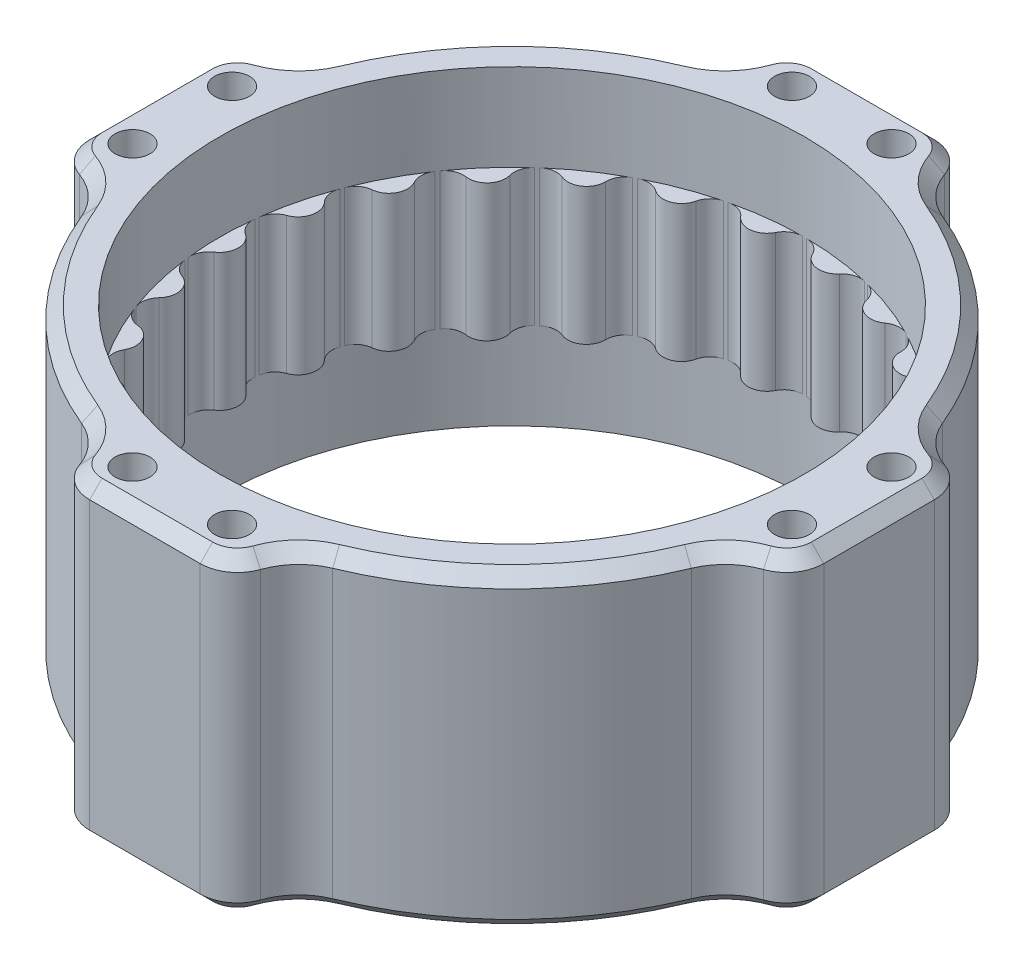
from build123d import *
from build123d.topology import SkipClean

# Parameters (mm, degrees)
SKETCH1_R                = 26.5
SKETCH1_R_2              = 23.5
BOSS_EXTRUDE4_DEPTH      = 11
SKETCH15_R               = 1.5
BOSS_EXTRUDE5_DEPTH      = 11
BOSS_EXTRUDE6_START      = 7
SKETCH7_R                = 26.5
SKETCH7_R_2              = 23.5
BOSS_EXTRUDE6_DEPTH      = 7
FILLET1_R                = 1.5
CIRPATTERN1_COUNT        = 26
FILLET1_OF_CIRPATTERN1_R = 1.5
SKETCH16_R               = 26.5
SKETCH16_R_2             = 23.5
BOSS_EXTRUDE7_DEPTH      = 7
SKETCH17_W               = 6
SKETCH17_H               = 14
BOSS_EXTRUDE8_DEPTH      = 25
SKETCH18_R               = 1.4
CUT_EXTRUDE1_DEPTH       = 25
FILLET2_R                = 5
FILLET3_R                = 3
CIRPATTERN2_COUNT        = 4
FILLET2_OF_CIRPATTERN2_R = 5
FILLET3_OF_CIRPATTERN2_R = 3
CHAMFER1_SIZE            = 1


with BuildPart() as part:
    # Sketch1 → Boss-Extrude4 (new body)
    with BuildSketch(Plane(origin=(0, 0, 0), x_dir=(1, 0, 0), z_dir=(0, 1, 0))):
        with Locations(Location((0, 0, 0), (0, 0, 270))):
            Circle(SKETCH1_R)
        with Locations(Location((0, 0, 0), (0, 0, 270))):
            Circle(SKETCH1_R_2, mode=Mode.SUBTRACT)
    extrude(amount=BOSS_EXTRUDE4_DEPTH)

    # Sketch15 → Boss-Extrude5 (add)
    with BuildSketch(Plane(origin=(0, 11, 0), x_dir=(1, 0, 0), z_dir=(0, 1, 0))):
        with Locations((-23.5, 0)):
            Circle(SKETCH15_R)
    boss_extrude5 = extrude(amount=-BOSS_EXTRUDE5_DEPTH)

    # Sketch7 → Boss-Extrude6 (add)
    with BuildSketch(Plane.XZ.offset(BOSS_EXTRUDE6_START)):
        with Locations(Location((0, 0, 0), (0, 0, 270))):
            Circle(SKETCH7_R)
        with Locations(Location((0, 0, 0), (0, 0, 270))):
            Circle(SKETCH7_R_2, mode=Mode.SUBTRACT)
    extrude(amount=-BOSS_EXTRUDE6_DEPTH)

    # Fillet1
    fillet1_edges = [part.edges().sort_by_distance(p)[0] for p in [
        (-23.45212766, 5.5, 1.499235885),
        (-23.45212766, 5.5, -1.499235885),
    ]]
    fillet(fillet1_edges, radius=FILLET1_R)

    # CirPattern1: Boss-Extrude5 ×26 about axis
    with SkipClean():  # the faces are left unmerged after this step: merging them gives an invalid solid
        cirpattern1_axis = Axis((0, 0, 0), (0, 1, 0))
        for i in range(1, CIRPATTERN1_COUNT):
            add(boss_extrude5.rotate(cirpattern1_axis, i * 360 / CIRPATTERN1_COUNT))
    add(part.part.scale(1), mode=Mode.REPLACE)  # the faces are merged on a copy

    # Fillet1 of CirPattern1
    fillet1_of_cirpattern1_edges = [part.edges().sort_by_distance(p)[0] for p in [
        (-22.411860821, 5.5, 7.068132325),
        (-23.129442084, 5.5, 4.156790695),
        (-20.069098094, 5.5, 12.226254605),
        (-21.462557407, 5.5, 9.571239709),
        (-16.559992335, 5.5, 16.673831409),
        (-18.548346906, 5.5, 14.429443061),
        (-12.088480015, 5.5, 20.152385738),
        (-14.556173904, 5.5, 18.449059631),
        (-6.914429175, 5.5, 22.459756659),
        (-9.718048984, 5.5, 21.396483916),
        (-1.338536846, 5.5, 23.461848161),
        (-4.31514638, 5.5, 23.100422328),
        (4.31514638, 5.5, 23.100422328),
        (1.338536846, 5.5, 23.461848161),
        (9.718048984, 5.5, 21.396483916),
        (6.914429175, 5.5, 22.459756659),
        (14.556173904, 5.5, 18.449059631),
        (12.088480015, 5.5, 20.152385738),
        (18.548346906, 5.5, 14.429443061),
        (16.559992335, 5.5, 16.673831409),
        (21.462557407, 5.5, 9.571239709),
        (20.069098094, 5.5, 12.226254605),
        (23.129442084, 5.5, 4.156790695),
        (22.411860821, 5.5, 7.068132325),
        (23.45212766, 5.5, -1.499235885),
        (23.45212766, 5.5, 1.499235885),
        (22.411860821, 5.5, -7.068132325),
        (23.129442084, 5.5, -4.156790695),
        (20.069098094, 5.5, -12.226254605),
        (21.462557407, 5.5, -9.571239709),
        (16.559992335, 5.5, -16.673831409),
        (18.548346906, 5.5, -14.429443061),
        (12.088480015, 5.5, -20.152385738),
        (14.556173904, 5.5, -18.449059631),
        (6.914429175, 5.5, -22.459756659),
        (9.718048984, 5.5, -21.396483916),
        (1.338536846, 5.5, -23.461848161),
        (4.31514638, 5.5, -23.100422328),
        (-4.31514638, 5.5, -23.100422328),
        (-1.338536846, 5.5, -23.461848161),
        (-9.718048984, 5.5, -21.396483916),
        (-6.914429175, 5.5, -22.459756659),
        (-14.556173904, 5.5, -18.449059631),
        (-12.088480015, 5.5, -20.152385738),
        (-18.548346906, 5.5, -14.429443061),
        (-16.559992335, 5.5, -16.673831409),
        (-21.462557407, 5.5, -9.571239709),
        (-20.069098094, 5.5, -12.226254605),
        (-23.129442084, 5.5, -4.156790695),
        (-22.411860821, 5.5, -7.068132325),
    ]]
    fillet(fillet1_of_cirpattern1_edges, radius=FILLET1_OF_CIRPATTERN1_R)

    # Sketch16 → Boss-Extrude7 (add)
    with BuildSketch(Plane(origin=(0, 11, 0), x_dir=(1, 0, 0), z_dir=(0, 1, 0))):
        with Locations(Location((0, 0, 0), (0, 0, 90))):
            Circle(SKETCH16_R)
        with Locations(Location((0, 0, 0), (0, 0, 90))):
            Circle(SKETCH16_R_2, mode=Mode.SUBTRACT)
    extrude(amount=BOSS_EXTRUDE7_DEPTH)

    # Sketch17 → Boss-Extrude8 (add)
    with BuildSketch(Plane(origin=(0, 18, 0), x_dir=(1, 0, 0), z_dir=(0, 1, 0))):
        with Locations((-26.5, 0)):
            Rectangle(SKETCH17_W, SKETCH17_H)
    boss_extrude8 = extrude(amount=-BOSS_EXTRUDE8_DEPTH)

    # Sketch18 → Cut-Extrude1 (cut)
    with BuildSketch(Plane(origin=(0, 18, 0), x_dir=(1, 0, 0), z_dir=(0, 1, 0))):
        with Locations(Location((-26.5, 4, 0), (0, 0, 270))):
            Circle(SKETCH18_R)
        with Locations(Location((-26.5, -4, 0), (0, 0, 270))):
            Circle(SKETCH18_R)
    cut_extrude1 = extrude(amount=-CUT_EXTRUDE1_DEPTH, mode=Mode.SUBTRACT)

    # Fillet2
    fillet2_edges = [part.edges().sort_by_distance(p)[0] for p in [
        (-25.558755838, 5.5, -7),
        (-25.558755838, 5.5, 7),
    ]]
    fillet(fillet2_edges, radius=FILLET2_R)

    # Fillet3
    fillet3_edges = [part.edges().sort_by_distance(p)[0] for p in [
        (-29.5, 5.5, 7),
        (-29.5, 5.5, -7),
    ]]
    fillet(fillet3_edges, radius=FILLET3_R)

    # CirPattern2: Boss-Extrude8, Cut-Extrude1 ×4 about axis
    cirpattern2_axis = Axis((0, 0, 0), (0, 1, 0))
    add([boss_extrude8.rotate(cirpattern2_axis, i * 360 / CIRPATTERN2_COUNT) for i in range(1, CIRPATTERN2_COUNT)])
    add([cut_extrude1.rotate(cirpattern2_axis, i * 360 / CIRPATTERN2_COUNT) for i in range(1, CIRPATTERN2_COUNT)], mode=Mode.SUBTRACT)

    # Fillet2 of CirPattern2
    fillet2_of_cirpattern2_edges = [part.edges().sort_by_distance(p)[0] for p in [
        (-7, 5.5, 25.558755838),
        (7, 5.5, 25.558755838),
        (25.558755838, 5.5, 7),
        (25.558755838, 5.5, -7),
        (7, 5.5, -25.558755838),
        (-7, 5.5, -25.558755838),
    ]]
    fillet(fillet2_of_cirpattern2_edges, radius=FILLET2_OF_CIRPATTERN2_R)

    # Fillet3 of CirPattern2
    fillet3_of_cirpattern2_edges = [part.edges().sort_by_distance(p)[0] for p in [
        (7, 5.5, 29.5),
        (-7, 5.5, 29.5),
        (29.5, 5.5, -7),
        (29.5, 5.5, 7),
        (-7, 5.5, -29.5),
        (7, 5.5, -29.5),
    ]]
    fillet(fillet3_of_cirpattern2_edges, radius=FILLET3_OF_CIRPATTERN2_R)

    # Chamfer1
    chamfer1_edges = [part.edges().sort_by_distance(p)[0] for p in [
        (-18.738329701, -7, -18.738329701),
        (-18.738329701, 18, 18.738329701),
        (-25.690553375, -7, 8.36593632),
        (-25.690553375, 18, -8.36593632),
        (-29.5, -7, 0),
        (-29.5, 18, 0),
        (-25.690553375, 18, 8.36593632),
        (-28.944670042, 18, -6.181679185),
        (-28.944670042, 18, 6.181679185),
        (-25.690553375, -7, -8.36593632),
        (-28.944670042, -7, -6.181679185),
        (-28.944670042, -7, 6.181679185),
        (18.738329701, 18, 18.738329701),
        (-18.738329701, -7, 18.738329701),
        (8.36593632, -7, 25.690553375),
        (-8.36593632, 18, 25.690553375),
        (18.738329701, 18, -18.738329701),
        (18.738329701, -7, 18.738329701),
        (25.690553375, -7, -8.36593632),
        (25.690553375, 18, 8.36593632),
        (-18.738329701, 18, -18.738329701),
        (18.738329701, -7, -18.738329701),
        (-8.36593632, -7, -25.690553375),
        (8.36593632, 18, -25.690553375),
        (0, -7, 29.5),
        (0, 18, 29.5),
        (8.36593632, 18, 25.690553375),
        (-6.181679185, 18, 28.944670042),
        (6.181679185, 18, 28.944670042),
        (-8.36593632, -7, 25.690553375),
        (-6.181679185, -7, 28.944670042),
        (6.181679185, -7, 28.944670042),
        (29.5, -7, 0),
        (29.5, 18, 0),
        (25.690553375, 18, -8.36593632),
        (28.944670042, 18, 6.181679185),
        (28.944670042, 18, -6.181679185),
        (25.690553375, -7, 8.36593632),
        (28.944670042, -7, 6.181679185),
        (28.944670042, -7, -6.181679185),
        (0, -7, -29.5),
        (0, 18, -29.5),
        (-8.36593632, 18, -25.690553375),
        (6.181679185, 18, -28.944670042),
        (-6.181679185, 18, -28.944670042),
        (8.36593632, -7, -25.690553375),
        (6.181679185, -7, -28.944670042),
        (-6.181679185, -7, -28.944670042),
    ]]
    chamfer(chamfer1_edges, length=CHAMFER1_SIZE)


solid = part.part
